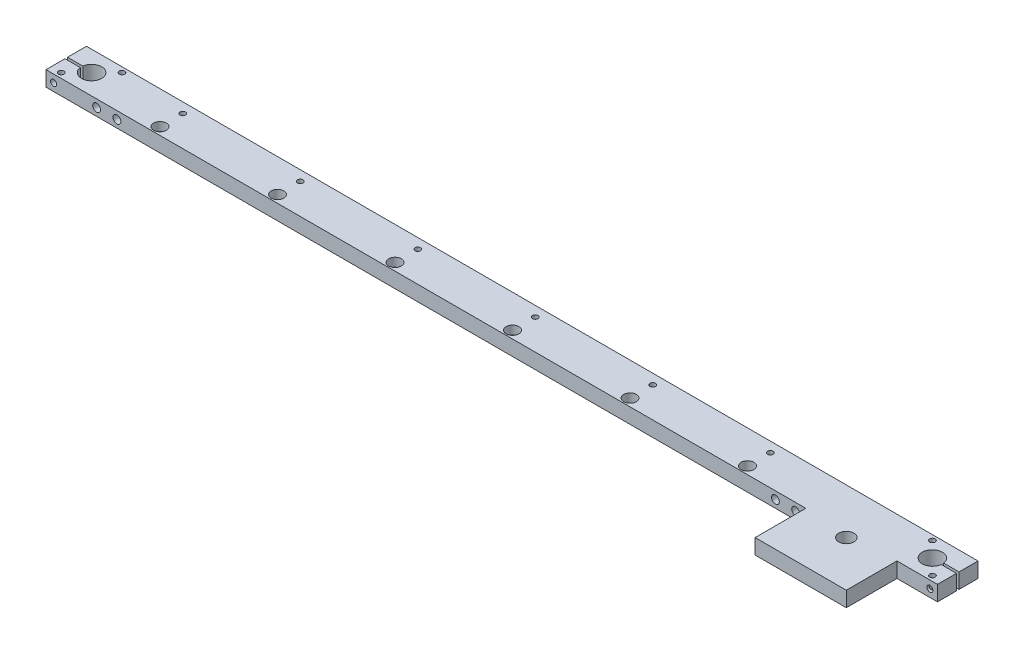
from build123d import *

# Parameters (mm, degrees)
BOSS_EXTRUDE1_DEPTH                            = 9.525
SKETCH2_W                                      = 1.89865
SKETCH2_H                                      = 43.65625
F_10_CLEARANCE_HOLE1_D                         = 5.1054
F_10_CLEARANCE_HOLE1_DEPTH                     = 11.90625
F_10_CLEARANCE_HOLE2_D                         = 5.1054
F_10_CLEARANCE_HOLE2_DEPTH                     = 11.90625
F_10_24_TAPPED_HOLE2_D                         = 3.7973
CBORE_FOR_8_SOCKET_HEAD_CAP_SCREW1_D           = 4.9149
CBORE_FOR_8_SOCKET_HEAD_CAP_SCREW1_CBORE_D     = 7.9375
CBORE_FOR_8_SOCKET_HEAD_CAP_SCREW1_CBORE_DEPTH = 16.8656
HOLE1_START                                    = 4.0894
HOLE1_OUTLINE_R                                = 1.7272
HOLE1_OUTLINE_R_2                              = 3.96875
HOLE1_OUTLINE_R_3                              = 4.7625
HOLE1_DEPTH                                    = 5.4356
HOLE1_2_OUTLINE_R                              = 1.7272
HOLE1_2_OUTLINE_R_2                            = 2.45745
HOLE1_2_OUTLINE_R_3                            = 4.7625
HOLE1_2_DEPTH                                  = 4.0894
HOLE1_3_OUTLINE_R                              = 6.35
HOLE1_3_OUTLINE_R_2                            = 4.7625
HOLE1_3_DEPTH                                  = 1.5875
F_8_32_TAPPED_HOLE2_D                          = 3.4544


# Read off the part's stored shape, not the designer's step: Hole1
with BuildPart() as part:
    # Sketch1 → Boss-Extrude1 (new body)
    with BuildSketch(Plane(origin=(0, 0, 0), x_dir=(1, 0, 0), z_dir=(0, 1, 0))):
        with BuildLine():
            Line((120.206642486, 6.011694636), (120.206642486, 17.917944636))
            Line((120.206642486, 17.917944636), (110.631837795, 17.917944636))
            ThreePointArc((110.631837795, 17.917944636), (97.981642486, 18.711694636), (110.631837795, 19.505444636))
            Line((110.631837795, 19.505444636), (120.206642486, 19.505444636))
            Line((120.206642486, 19.505444636), (120.206642486, 31.411694636))
            Line((120.206642486, 31.411694636), (-438.593357514, 31.411694636))
            Line((-438.593357514, 31.411694636), (-438.593357514, 19.505444636))
            Line((-438.593357514, 19.505444636), (-429.018552824, 19.505444636))
            ThreePointArc((-429.018552824, 19.505444636), (-416.368357514, 18.711694636), (-429.018552824, 17.917944636))
            Line((-429.018552824, 17.917944636), (-438.593357514, 17.917944636))
            Line((-438.593357514, 17.917944636), (-438.593357514, 6.011694636))
            Line((-438.593357514, 6.011694636), (37.656642486, 6.011694636))
            Line((37.656642486, 6.011694636), (37.656642486, -25.738305364))
            Line((37.656642486, -25.738305364), (94.806642486, -25.738305364))
            Line((94.806642486, -25.738305364), (94.806642486, 6.011694636))
            Line((94.806642486, 6.011694636), (120.206642486, 6.011694636))
        make_face()
    extrude(amount=BOSS_EXTRUDE1_DEPTH)

    # Sketch2 → #10-24 Tapped Hole1 (revolve, cut)
    with BuildSketch(Plane(origin=(115.444142486, 4.7625, -17.917944636), x_dir=(0, 1, 0), z_dir=(1, 0, 0))):
        with Locations((0.949325, 21.828125)):
            Rectangle(SKETCH2_W, SKETCH2_H)
    revolve(axis=Axis((115.444142486, 4.7625, -24.267944636), (0, 0, 1)), mode=Mode.SUBTRACT)

    # #10 Clearance Hole1
    with Locations(Plane(origin=(0, 0, -31.411694636), x_dir=(-1, 0, 0), z_dir=(0, 0, -1))):
        with Locations((-115.444142486, 4.7625)):
            Hole(F_10_CLEARANCE_HOLE1_D / 2, depth=F_10_CLEARANCE_HOLE1_DEPTH)

    # #10 Clearance Hole2
    with Locations(Plane(origin=(0, 0, -31.411694636), x_dir=(-1, 0, 0), z_dir=(0, 0, -1))):
        with Locations((433.830857514, 4.7625)):
            Hole(F_10_CLEARANCE_HOLE2_D / 2, depth=F_10_CLEARANCE_HOLE2_DEPTH)

    # #10-24 Tapped Hole2 (through all)
    with Locations(Plane(origin=(0, 0, -17.917944636), x_dir=(-1, 0, 0), z_dir=(0, 0, -1))):
        with Locations((433.830857514, 4.7625)):
            Hole(F_10_24_TAPPED_HOLE2_D / 2)

    # CBORE for #8 Socket Head Cap Screw1 (through all)
    with Locations(Plane(origin=(0, 0, -31.411694636), x_dir=(-1, 0, 0), z_dir=(0, 0, -1))):
        with Locations((-31.306642486, 4.7625), (-18.606642486, 4.7625), (406.843357514, 4.7625), (394.143357514, 4.7625)):
            CounterBoreHole(CBORE_FOR_8_SOCKET_HEAD_CAP_SCREW1_D / 2, CBORE_FOR_8_SOCKET_HEAD_CAP_SCREW1_CBORE_D / 2, CBORE_FOR_8_SOCKET_HEAD_CAP_SCREW1_CBORE_DEPTH)

    # Hole1 outline → Hole1 (cut)
    with BuildSketch(Plane(origin=(0, 0, 0), x_dir=(1, 0, 0), z_dir=(0, 1, 0)).offset(HOLE1_START)):
        with Locations((-3.618357514, 25.061694636)):
            Circle(HOLE1_OUTLINE_R)
        with Locations((-77.278357514, 25.061694636)):
            Circle(HOLE1_OUTLINE_R)
        with Locations((-150.938357514, 25.061694636)):
            Circle(HOLE1_OUTLINE_R)
        with Locations((-224.598357514, 25.061694636)):
            Circle(HOLE1_OUTLINE_R)
        with Locations((-298.258357514, 25.061694636)):
            Circle(HOLE1_OUTLINE_R)
        with Locations((-371.918357514, 25.061694636)):
            Circle(HOLE1_OUTLINE_R)
        with Locations((-3.618357514, 10.774194636)):
            Circle(HOLE1_OUTLINE_R_2)
        with Locations((-77.278357514, 10.774194636)):
            Circle(HOLE1_OUTLINE_R_2)
        with Locations((-150.938357514, 10.774194636)):
            Circle(HOLE1_OUTLINE_R_2)
        with Locations((-224.598357514, 10.774194636)):
            Circle(HOLE1_OUTLINE_R_2)
        with Locations((-298.258357514, 10.774194636)):
            Circle(HOLE1_OUTLINE_R_2)
        with Locations((-371.918357514, 10.774194636)):
            Circle(HOLE1_OUTLINE_R_2)
        with Locations((66.231642486, 2.836694636)):
            Circle(HOLE1_OUTLINE_R_3)
    extrude(amount=HOLE1_DEPTH, mode=Mode.SUBTRACT)

    # Hole1 2 outline → Hole1 2 (cut)
    with BuildSketch(Plane(origin=(0, 0, 0), x_dir=(1, 0, 0), z_dir=(0, 1, 0))):
        with Locations((-3.618357514, 25.061694636)):
            Circle(HOLE1_2_OUTLINE_R)
        with Locations((-77.278357514, 25.061694636)):
            Circle(HOLE1_2_OUTLINE_R)
        with Locations((-150.938357514, 25.061694636)):
            Circle(HOLE1_2_OUTLINE_R)
        with Locations((-224.598357514, 25.061694636)):
            Circle(HOLE1_2_OUTLINE_R)
        with Locations((-298.258357514, 25.061694636)):
            Circle(HOLE1_2_OUTLINE_R)
        with Locations((-371.918357514, 25.061694636)):
            Circle(HOLE1_2_OUTLINE_R)
        with Locations((-3.618357514, 10.774194636)):
            Circle(HOLE1_2_OUTLINE_R_2)
        with Locations((-77.278357514, 10.774194636)):
            Circle(HOLE1_2_OUTLINE_R_2)
        with Locations((-150.938357514, 10.774194636)):
            Circle(HOLE1_2_OUTLINE_R_2)
        with Locations((-224.598357514, 10.774194636)):
            Circle(HOLE1_2_OUTLINE_R_2)
        with Locations((-298.258357514, 10.774194636)):
            Circle(HOLE1_2_OUTLINE_R_2)
        with Locations((-371.918357514, 10.774194636)):
            Circle(HOLE1_2_OUTLINE_R_2)
        with Locations((66.231642486, 2.836694636)):
            Circle(HOLE1_2_OUTLINE_R_3)
    extrude(amount=HOLE1_2_DEPTH, mode=Mode.SUBTRACT)

    # Hole1 3 outline → Hole1 3 (cut)
    with BuildSketch(Plane(origin=(0, 0, 0), x_dir=(1, 0, 0), z_dir=(0, 1, 0))):
        with Locations((66.231642486, 2.836694636)):
            Circle(HOLE1_3_OUTLINE_R)
        with Locations((66.231642486, 2.836694636)):
            Circle(HOLE1_3_OUTLINE_R_2, mode=Mode.SUBTRACT)
    extrude(amount=HOLE1_3_DEPTH, mode=Mode.SUBTRACT)

    # #8-32 Tapped Hole2 (through all)
    with Locations(Plane(origin=(0, 0, 0), x_dir=(-1, 0, 0), z_dir=(0, -1, 0))):
        with Locations((-94.806642486, 28.236694636), (-113.856642486, 9.186694636), (432.243357514, 9.186694636), (413.193357514, 28.236694636)):
            Hole(F_8_32_TAPPED_HOLE2_D / 2)


solid = part.part
